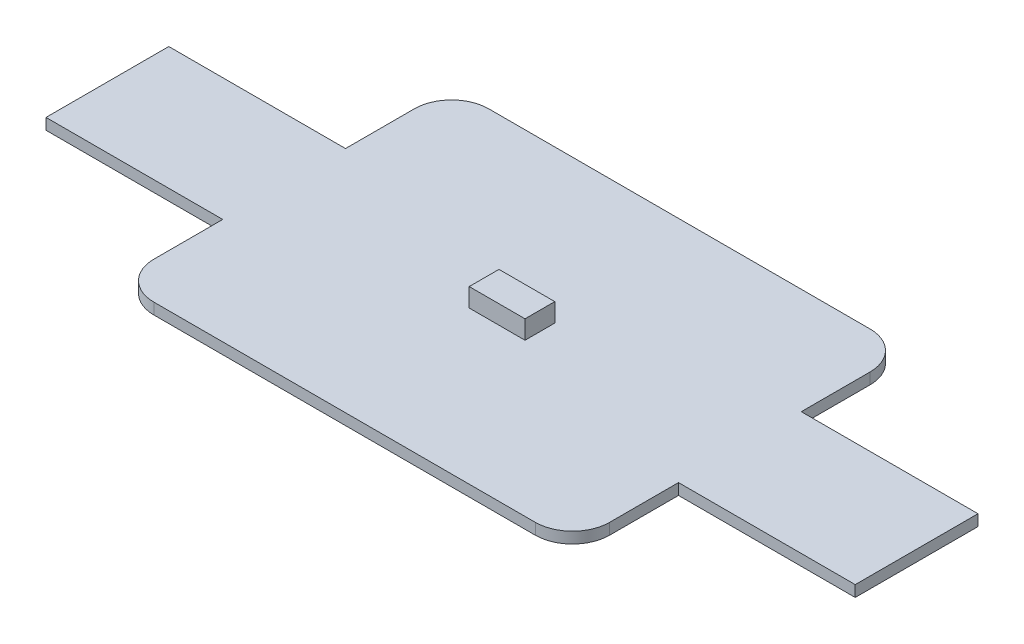
from build123d import *

# Parameters (mm, degrees)
STOCK_MODIFYCOMPONENTPART_1_START = 6
STOCK_MODIFYCOMPONENTPART_1_DEPTH = 0.6
SKETCH1_W                         = 3
SKETCH1_H                         = 1.6
BOSS_EXTRUDE1_DEPTH               = 1


# Read off the part's stored shape, not the designer's step: Stock-ModifyComponentPart-1
with BuildPart() as part:
    # Stock-ModifyComponentPart-1 outline → Stock-ModifyComponentPart-1 (new body)
    with BuildSketch(Plane(origin=(0, 0, 0), x_dir=(1, 0, 0), z_dir=(0, 1, 0)).offset(STOCK_MODIFYCOMPONENTPART_1_START)):
        with BuildLine():
            Line((12.25, 3.3), (12.25, 7))
            ThreePointArc((12.25, 7), (11.664213562, 8.414213562), (10.25, 9))
            Line((10.25, 9), (-10.25, 9))
            ThreePointArc((-10.25, 9), (-11.664213562, 8.414213562), (-12.25, 7))
            Line((-12.25, 7), (-12.25, 3.3))
            Line((-12.25, 3.3), (-21.75, 3.3))
            Line((-21.75, 3.3), (-21.75, -3.3))
            Line((-21.75, -3.3), (-12.25, -3.3))
            Line((-12.25, -3.3), (-12.25, -7))
            ThreePointArc((-12.25, -7), (-11.664213562, -8.414213562), (-10.25, -9))
            Line((-10.25, -9), (10.25, -9))
            ThreePointArc((10.25, -9), (11.664213562, -8.414213562), (12.25, -7))
            Line((12.25, -7), (12.25, -3.3))
            Line((12.25, -3.3), (21.75, -3.3))
            Line((21.75, -3.3), (21.75, 3.3))
            Line((21.75, 3.3), (12.25, 3.3))
        make_face()
    extrude(amount=STOCK_MODIFYCOMPONENTPART_1_DEPTH)

    # Sketch1 → Boss-Extrude1 (add)
    with BuildSketch(Plane(origin=(0, 6.6, 0), x_dir=(1, 0, 0), z_dir=(0, 1, 0))):
        Rectangle(SKETCH1_W, SKETCH1_H)
    extrude(amount=BOSS_EXTRUDE1_DEPTH)


solid = part.part
